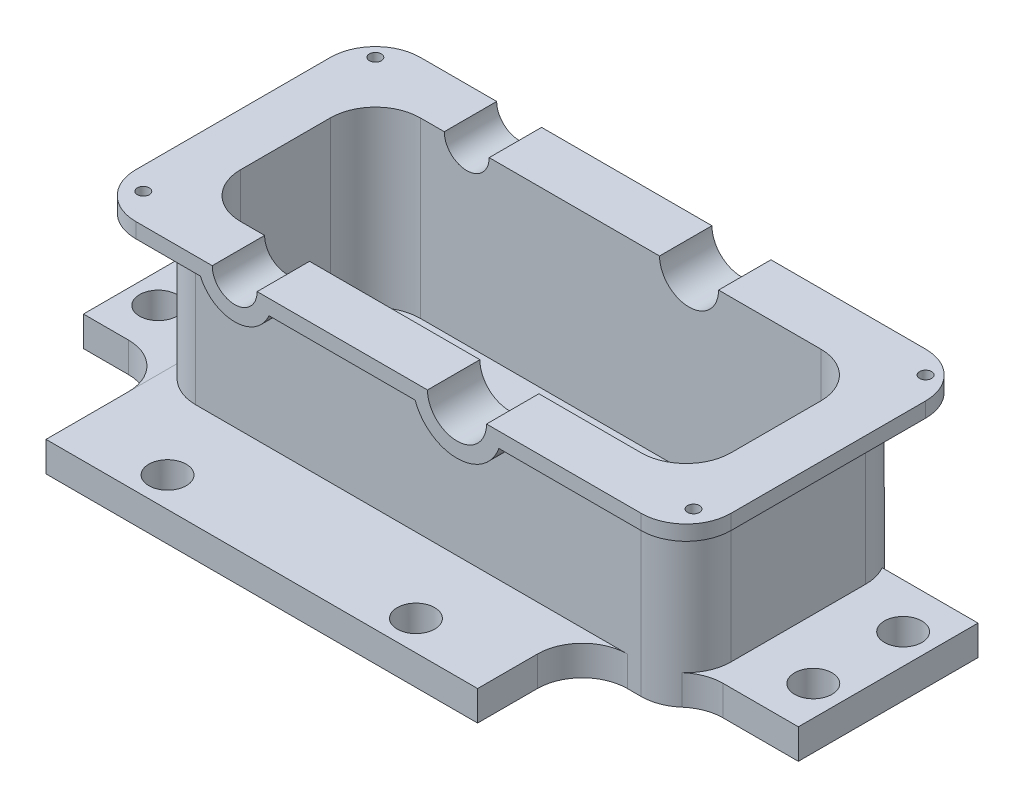
from build123d import *

# Parameters (mm, degrees)
SKETCH_2_W                = 357.553894744
SKETCH_2_H                = 150
EXTRUDE_1_DEPTH           = 10
SKETCH_3_W                = 357.553894744
SKETCH_3_H                = 150
SKETCH_3_W_2              = 327.553894744
SKETCH_3_H_2              = 120
EXTRUDE_2_DEPTH           = 140
CUT_EXTRUDE_1_DEPTH       = 855.433272333
CUT_EXTRUDE_1_DEPTH_BACK  = 855.433272333
CUT_EXTRUDE_2_DEPTH       = 841.042985132
CUT_EXTRUDE_2_DEPTH_BACK  = 841.042985132
SKETCH_5_R                = 19.713844825
SKETCH_6_W                = 288.287901075
SKETCH_6_H                = 70
EXTRUDE_3_DEPTH           = 20
CUT_EXTRUDE_3_DEPTH       = 715.76724664
CUT_EXTRUDE_3_DEPTH_BACK  = 715.76724664
SKETCH_7_R                = 12.5
CUT_EXTRUDE_4_DEPTH       = 856.319950001
CUT_EXTRUDE_4_DEPTH_BACK  = 856.319950001
SKETCH_8_R                = 15
SKETCH_10_W               = 60
SKETCH_10_H               = 120
EXTRUDE_5_DEPTH           = 20
FILLET_4_R                = 30
FILLET_5_R                = 30
FILLET_6_R                = 30
FILLET_7_R                = 30
FILLET_8_R                = 30
EXTRUDE_6_DEPTH           = 10
CUT_EXTRUDE_5_DEPTH       = 899.965274634
CUT_EXTRUDE_5_DEPTH_BACK  = 899.965274634
SKETCH_12_R               = 15
SKETCH_12_R_2             = 19.713844825
SKETCH_13_R               = 25
SKETCH_13_R_2             = 15
SKETCH_13_R_3             = 29.713844825
SKETCH_13_R_4             = 19.713844825
EXTRUDE_7_DEPTH           = 20
CUT_EXTRUDE_7_DEPTH       = 913.45416961
CUT_EXTRUDE_7_DEPTH_BACK  = 913.45416961
CUT_EXTRUDE_8_DEPTH       = 913.45416961
CUT_EXTRUDE_8_DEPTH_BACK  = 913.45416961
EXTRUDE_START             = 20
SKETCH_16_R               = 29.713844825
SKETCH_16_R_2             = 25
EXTRUDE_8_DEPTH           = 20
CUT_EXTRUDE_9_DEPTH       = 909.500199031
CUT_EXTRUDE_9_DEPTH_BACK  = 909.500199031
SKETCH_17_R               = 15
SKETCH_17_R_2             = 19.713844825
CUT_EXTRUDE_10_DEPTH      = 920.169522797
CUT_EXTRUDE_10_DEPTH_BACK = 920.169522797
CUT_EXTRUDE_11_DEPTH      = 781.303508257
CUT_EXTRUDE_11_DEPTH_BACK = 50
SKETCH_19_R               = 4
SKETCH_20_R               = 12.5
CUT_EXTRUDE_12_DEPTH      = 70


with BuildPart() as part:
    # 草图2 → 凸台-拉伸1 (new body)
    with BuildSketch(Plane(origin=(0, 370, 0), x_dir=(1, 0, 0), z_dir=(0, 1, 0))):
        with Locations((-482.400953703, 175)):
            Rectangle(SKETCH_2_W, SKETCH_2_H)
    extrude(amount=EXTRUDE_1_DEPTH)

    # 草图3 → 凸台-拉伸2 (add)
    with BuildSketch(Plane(origin=(0, 380, 0), x_dir=(1, 0, 0), z_dir=(0, 1, 0))):
        with Locations((-482.400953703, 175)):
            Rectangle(SKETCH_3_W, SKETCH_3_H)
        with Locations((-482.400953703, 175)):
            Rectangle(SKETCH_3_W_2, SKETCH_3_H_2, mode=Mode.SUBTRACT)
    extrude(amount=EXTRUDE_2_DEPTH)

    # 草图4 → 切除-拉伸1 (cut, two sides: drawn at the far end of the back side and taken through both)
    with BuildSketch(Plane(origin=(0, 0, -250), x_dir=(-1, 0, 0), z_dir=(0, 0, -1)).offset(-CUT_EXTRUDE_1_DEPTH_BACK)):
        Polygon((436.64, 496), (179.513025855, 496), (179.513025855, 596.740447495), (436.64, 596.740447495), (733.186864443, 596.740447495), (733.186864443, 496), align=None)
    extrude(amount=CUT_EXTRUDE_1_DEPTH + CUT_EXTRUDE_1_DEPTH_BACK, mode=Mode.SUBTRACT)

    # 草图5 → 切除-拉伸2 (cut, two sides: drawn at the far end of the back side and taken through both)
    with BuildSketch(Plane(origin=(0, 0, -250), x_dir=(-1, 0, 0), z_dir=(0, 0, -1)).offset(-CUT_EXTRUDE_2_DEPTH_BACK)):
        with Locations((436.64, 496)):
            Circle(SKETCH_5_R)
    extrude(amount=CUT_EXTRUDE_2_DEPTH + CUT_EXTRUDE_2_DEPTH_BACK, mode=Mode.SUBTRACT)

    # 草图6 → 凸台-拉伸3 (add)
    with BuildSketch(Plane(origin=(0, 370, 0), x_dir=(-1, 0, 0), z_dir=(0, -1, 0))):
        with Locations((517.033950538, 65)):
            Rectangle(SKETCH_6_W, SKETCH_6_H)
    extrude(amount=-EXTRUDE_3_DEPTH)

    # 草图7 → 切除-拉伸3 (cut, two sides: drawn at the far end of the back side and taken through both)
    with BuildSketch(Plane(origin=(0, 390, 0), x_dir=(1, 0, 0), z_dir=(0, 1, 0)).offset(-CUT_EXTRUDE_3_DEPTH_BACK)):
        with Locations(Location((-600, 50, 0), (0, 0, 270))):
            Circle(SKETCH_7_R)
        with Locations(Location((-434.07, 50, 0), (0, 0, 270))):
            Circle(SKETCH_7_R)
    extrude(amount=CUT_EXTRUDE_3_DEPTH + CUT_EXTRUDE_3_DEPTH_BACK, mode=Mode.SUBTRACT)

    # 草图8 → 切除-拉伸4 (cut, two sides: drawn at the far end of the back side and taken through both)
    with BuildSketch(Plane(origin=(0, 0, -250), x_dir=(-1, 0, 0), z_dir=(0, 0, -1)).offset(-CUT_EXTRUDE_4_DEPTH_BACK)):
        with Locations((585.14, 496)):
            Circle(SKETCH_8_R)
    extrude(amount=CUT_EXTRUDE_4_DEPTH + CUT_EXTRUDE_4_DEPTH_BACK, mode=Mode.SUBTRACT)

    # 草图10 → 凸台-拉伸5 (add)
    with BuildSketch(Plane.XZ.offset(-370)):
        with Locations((-691.177901075, -175)):
            Rectangle(SKETCH_10_W, SKETCH_10_H)
        with Locations((-273.624006331, -175)):
            Rectangle(SKETCH_10_W, SKETCH_10_H)
    extrude(amount=-EXTRUDE_5_DEPTH)

    # 圆角4
    # the kernel refuses this fillet: 30 mm, written as the material it takes off along each edge
    with BuildSketch(Plane(origin=(-303.624006331, 571, -250), x_dir=(-1, 0, 0), z_dir=(0, -1, 0))) as fillet_4_piece_1_section:
        with BuildLine():
            CenterArc((FILLET_4_R, -FILLET_4_R), FILLET_4_R, 90, 90)
            Line((0, -FILLET_4_R), (0, 0))
            Line((0, 0), (FILLET_4_R, 0))
        make_face()
    fillet_4_piece_1 = extrude(amount=276, mode=Mode.PRIVATE)
    fillet_4_piece_1 = split(fillet_4_piece_1, bisect_by=Plane(origin=(-310.944751812, 390, -244.648122102), z_dir=(0, 1, 0)), keep=Keep.TOP, mode=Mode.PRIVATE)
    add(fillet_4_piece_1, mode=Mode.SUBTRACT)
    with BuildSketch(Plane(origin=(-303.624006331, 571, -250), x_dir=(-1, 0, 0), z_dir=(0, -1, 0))) as fillet_4_piece_2_section:
        with BuildLine():
            CenterArc((FILLET_4_R, -FILLET_4_R), FILLET_4_R, 90, 90)
            Line((0, -FILLET_4_R), (0, 0))
            Line((0, 0), (FILLET_4_R, 0))
        make_face()
    fillet_4_piece_2 = extrude(amount=276, mode=Mode.PRIVATE)
    fillet_4_piece_2 = split(fillet_4_piece_2, bisect_by=Plane(origin=(-310.944751812, 380, -235), z_dir=(0, 0, -1)), keep=Keep.TOP, mode=Mode.PRIVATE)
    add(fillet_4_piece_2, mode=Mode.SUBTRACT)
    with BuildSketch(Plane(origin=(-303.624006331, 571, -100), x_dir=(0, 0, -1), z_dir=(0, -1, 0))) as fillet_4_piece_3_section:
        with BuildLine():
            CenterArc((FILLET_4_R, -FILLET_4_R), FILLET_4_R, 90, 90)
            Line((0, -FILLET_4_R), (0, 0))
            Line((0, 0), (FILLET_4_R, 0))
        make_face()
    fillet_4_piece_3 = extrude(amount=276, mode=Mode.PRIVATE)
    fillet_4_piece_3 = split(fillet_4_piece_3, bisect_by=Plane(origin=(-304.814544111, 390, -118.697908378), z_dir=(0, 1, 0)), keep=Keep.TOP, mode=Mode.PRIVATE)
    add(fillet_4_piece_3, mode=Mode.SUBTRACT)
    with BuildSketch(Plane(origin=(-303.624006331, 571, -100), x_dir=(0, 0, -1), z_dir=(0, -1, 0))) as fillet_4_piece_4_section:
        with BuildLine():
            CenterArc((FILLET_4_R, -FILLET_4_R), FILLET_4_R, 90, 90)
            Line((0, -FILLET_4_R), (0, 0))
            Line((0, 0), (FILLET_4_R, 0))
        make_face()
    fillet_4_piece_4 = extrude(amount=276, mode=Mode.PRIVATE)
    fillet_4_piece_4 = split(fillet_4_piece_4, bisect_by=Plane(origin=(-310.944751812, 380, -115), z_dir=(0, 0, 1)), keep=Keep.TOP, mode=Mode.PRIVATE)
    add(fillet_4_piece_4, mode=Mode.SUBTRACT)
    with BuildSketch(Plane(origin=(-661.177901075, 295, -250), x_dir=(1, 0, 0), z_dir=(0, 1, 0))) as fillet_4_piece_5_section:
        with BuildLine():
            CenterArc((FILLET_4_R, -FILLET_4_R), FILLET_4_R, 90, 90)
            Line((0, -FILLET_4_R), (0, 0))
            Line((0, 0), (FILLET_4_R, 0))
        make_face()
    fillet_4_piece_5 = extrude(amount=276, mode=Mode.PRIVATE)
    fillet_4_piece_5 = split(fillet_4_piece_5, bisect_by=Plane(origin=(-653.857155594, 380, -235), z_dir=(0, 0, -1)), keep=Keep.TOP, mode=Mode.PRIVATE)
    add(fillet_4_piece_5, mode=Mode.SUBTRACT)
    with BuildSketch(Plane(origin=(-661.177901075, 295, -250), x_dir=(1, 0, 0), z_dir=(0, 1, 0))) as fillet_4_piece_6_section:
        with BuildLine():
            CenterArc((FILLET_4_R, -FILLET_4_R), FILLET_4_R, 90, 90)
            Line((0, -FILLET_4_R), (0, 0))
            Line((0, 0), (FILLET_4_R, 0))
        make_face()
    fillet_4_piece_6 = extrude(amount=276, mode=Mode.PRIVATE)
    fillet_4_piece_6 = split(fillet_4_piece_6, bisect_by=Plane(origin=(-659.987363294, 390, -231.302091622), z_dir=(0, 1, 0)), keep=Keep.TOP, mode=Mode.PRIVATE)
    add(fillet_4_piece_6, mode=Mode.SUBTRACT)
    with BuildSketch(Plane(origin=(-661.177901075, 390, -100), x_dir=(0, 0, -1), z_dir=(0, 1, 0))) as fillet_4_piece_7:
        with BuildLine():
            CenterArc((FILLET_4_R, -FILLET_4_R), FILLET_4_R, 90, 90)
            Line((0, -FILLET_4_R), (0, 0))
            Line((0, 0), (FILLET_4_R, 0))
        make_face()
    extrude(amount=181, mode=Mode.SUBTRACT)

    # 圆角5
    fillet_5_edges = [part.edges().sort_by_distance(p)[0] for p in [
        (-318.624006331, 438, -115),
        (-318.624006331, 438, -235),
        (-646.177901075, 438, -115),
        (-646.177901075, 438, -235),
    ]]
    fillet(fillet_5_edges, radius=FILLET_5_R)

    # 圆角6
    fillet_6_edges = [part.edges().sort_by_distance(p)[0] for p in [
        (-661.177901075, 380, -115),
        (-372.89, 380, -100),
    ]]
    fillet(fillet_6_edges, radius=FILLET_6_R)

    # 圆角7
    fillet_7_edges = [part.edges().sort_by_distance(p)[0] for p in [
        (-307.643244217, 380, -115),
    ]]
    fillet(fillet_7_edges, radius=FILLET_7_R)

    # 圆角8
    fillet_8_edges = [part.edges().sort_by_distance(p)[0] for p in [
        (-657.158663188, 380, -235),
    ]]
    fillet(fillet_8_edges, radius=FILLET_8_R)

    # 草图11 → 凸台-拉伸6 (add)
    with BuildSketch(Plane(origin=(0, 496, 0), x_dir=(1, 0, 0), z_dir=(0, 1, 0))):
        with BuildLine():
            ThreePointArc((-651.177901075, 270), (-672.39110451, 261.213203436), (-681.177901075, 240))
            Line((-681.177901075, 240), (-681.177901075, 110))
            ThreePointArc((-681.177901075, 110), (-672.39110451, 88.786796564), (-651.177901075, 80))
            Line((-651.177901075, 80), (-313.624006331, 80))
            ThreePointArc((-313.624006331, 80), (-292.410802895, 88.786796564), (-283.624006331, 110))
            Line((-283.624006331, 110), (-283.624006331, 240))
            ThreePointArc((-283.624006331, 240), (-292.410802895, 261.213203436), (-313.624006331, 270))
            Line((-313.624006331, 270), (-651.177901075, 270))
        make_face()
        with BuildLine():
            Line((-600.14, 250), (-456.353844825, 250))
            Line((-456.353844825, 250), (-416.926155175, 250))
            Line((-416.926155175, 250), (-333.624006331, 250))
            ThreePointArc((-333.624006331, 250), (-312.410802895, 241.213203436), (-303.624006331, 220))
            Line((-303.624006331, 220), (-303.624006331, 130))
            ThreePointArc((-303.624006331, 130), (-312.410802895, 108.786796564), (-333.624006331, 100))
            Line((-333.624006331, 100), (-600.14, 100))
            Line((-600.14, 100), (-631.177901075, 100))
            ThreePointArc((-631.177901075, 100), (-652.39110451, 108.786796564), (-661.177901075, 130))
            Line((-661.177901075, 130), (-661.177901075, 220))
            ThreePointArc((-661.177901075, 220), (-652.39110451, 241.213203436), (-631.177901075, 250))
            Line((-631.177901075, 250), (-600.14, 250))
        make_face(mode=Mode.SUBTRACT)
    extrude(amount=-EXTRUDE_6_DEPTH)

    # 草图12 → 切除-拉伸5 (cut, two sides: drawn at the far end of the back side and taken through both)
    with BuildSketch(Plane.XY.offset(-235).offset(-CUT_EXTRUDE_5_DEPTH_BACK)):
        with Locations((-585.14, 496)):
            Circle(SKETCH_12_R)
        with Locations((-436.64, 496)):
            Circle(SKETCH_12_R_2)
    extrude(amount=CUT_EXTRUDE_5_DEPTH + CUT_EXTRUDE_5_DEPTH_BACK, mode=Mode.SUBTRACT)

    # 草图13 → 凸台-拉伸7 (add)
    # profile 1 of 2: a face of its own
    with BuildSketch(Plane.XY.offset(-100)):
        with Locations((-585.14, 496)):
            Circle(SKETCH_13_R)
        with Locations((-585.14, 496)):
            Circle(SKETCH_13_R_2, mode=Mode.SUBTRACT)
    # profile 2 of 2: a face of its own
    with BuildSketch(Plane.XY.offset(-100)):
        with Locations((-436.64, 496)):
            Circle(SKETCH_13_R_3)
        with Locations((-436.64, 496)):
            Circle(SKETCH_13_R_4, mode=Mode.SUBTRACT)
    extrude(amount=EXTRUDE_7_DEPTH)

    # 草图14 → 切除-拉伸7 (cut, two sides: drawn at the far end of the back side and taken through both)
    with BuildSketch(Plane.XY.offset(-80).offset(-CUT_EXTRUDE_7_DEPTH_BACK)):
        with BuildLine():
            ThreePointArc((-600.14, 496), (-585.14, 511), (-570.14, 496))
            Line((-570.14, 496), (-560.14, 496))
            ThreePointArc((-560.14, 496), (-585.14, 521), (-610.14, 496))
            Line((-610.14, 496), (-600.14, 496))
        make_face()
    extrude(amount=CUT_EXTRUDE_7_DEPTH + CUT_EXTRUDE_7_DEPTH_BACK, mode=Mode.SUBTRACT)

    # 草图15 → 切除-拉伸8 (cut, two sides: drawn at the far end of the back side and taken through both)
    with BuildSketch(Plane.XY.offset(-80).offset(-CUT_EXTRUDE_8_DEPTH_BACK)):
        Polygon((-483.519236307, 496), (-384.81297166, 496), (-391.380879004, 542.181337099), (-485.395781263, 523.415887546), align=None)
    extrude(amount=CUT_EXTRUDE_8_DEPTH + CUT_EXTRUDE_8_DEPTH_BACK, mode=Mode.SUBTRACT)

    # 草图16 → 凸台-拉伸8 (add)
    with BuildSketch(Plane(origin=(0, 0, -250), x_dir=(-1, 0, 0), z_dir=(0, 0, -1)).offset(EXTRUDE_START)):
        with Locations((436.64, 496)):
            Circle(SKETCH_16_R)
        with Locations((585.14, 496)):
            Circle(SKETCH_16_R_2)
    extrude(amount=-EXTRUDE_8_DEPTH)

    # 草图17 → 切除-拉伸9 (cut, two sides: drawn at the far end of the back side and taken through both)
    with BuildSketch(Plane.XY.offset(-100).offset(-CUT_EXTRUDE_9_DEPTH_BACK)):
        with Locations((-585.14, 496)):
            Circle(SKETCH_17_R)
        with Locations((-436.64, 496)):
            Circle(SKETCH_17_R_2)
    extrude(amount=CUT_EXTRUDE_9_DEPTH + CUT_EXTRUDE_9_DEPTH_BACK, mode=Mode.SUBTRACT)

    # 草图18 → 切除-拉伸10 (cut, two sides: drawn at the far end of the back side and taken through both)
    with BuildSketch(Plane(origin=(0, 0, -250), x_dir=(-1, 0, 0), z_dir=(0, 0, -1)).offset(-CUT_EXTRUDE_10_DEPTH_BACK)):
        Polygon((376.640943125, 496), (644.852141122, 496), (631.989437133, 582.438917855), (371.35878546, 543.655288835), align=None)
    extrude(amount=CUT_EXTRUDE_10_DEPTH + CUT_EXTRUDE_10_DEPTH_BACK, mode=Mode.SUBTRACT)

    # 草图19 → 切除-拉伸11 (cut, two sides: drawn at the far end of the back side and taken through both)
    with BuildSketch(Plane(origin=(0, 496, 0), x_dir=(1, 0, 0), z_dir=(0, 1, 0)).offset(-CUT_EXTRUDE_11_DEPTH_BACK)):
        with Locations(Location((-666.177901075, 255, 0), (0, 0, 90))):
            Circle(SKETCH_19_R)
        with Locations(Location((-666.177901075, 100, 0), (0, 0, 90))):
            Circle(SKETCH_19_R)
        with Locations(Location((-298.624006331, 100, 0), (0, 0, 90))):
            Circle(SKETCH_19_R)
        with Locations(Location((-298.624006331, 255, 0), (0, 0, 90))):
            Circle(SKETCH_19_R)
    extrude(amount=CUT_EXTRUDE_11_DEPTH + CUT_EXTRUDE_11_DEPTH_BACK, mode=Mode.SUBTRACT)

    # 草图20 → 切除-拉伸12 (cut)
    with BuildSketch(Plane(origin=(0, 390, 0), x_dir=(1, 0, 0), z_dir=(0, 1, 0))):
        with Locations(Location((-701.177901075, 205, 0), (0, 0, 270))):
            Circle(SKETCH_20_R)
        with Locations(Location((-701.177901075, 145, 0), (0, 0, 270))):
            Circle(SKETCH_20_R)
        with Locations(Location((-263.624006331, 205, 0), (0, 0, 270))):
            Circle(SKETCH_20_R)
        with Locations(Location((-263.624006331, 145, 0), (0, 0, 270))):
            Circle(SKETCH_20_R)
    extrude(amount=-CUT_EXTRUDE_12_DEPTH, mode=Mode.SUBTRACT)


solid = part.part
